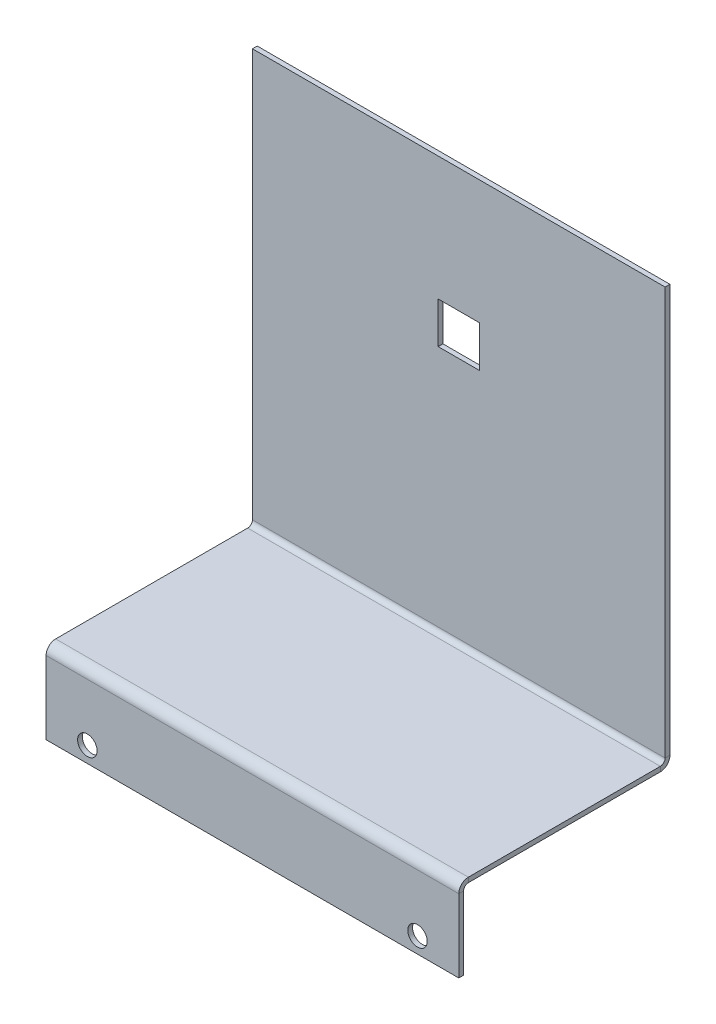
from build123d import *

# Parameters (mm, degrees)
BASE_FLANGE1_DEPTH = 63.5
HOLE1_START        = 28.172610526
HOLE1_OUTLINE_R    = 1.5
HOLE1_DEPTH        = 0.7366
SKETCH8_W          = 6.35
SKETCH8_H          = 6.35
CUT_EXTRUDE1_DEPTH = 90.436486872


# Read off the part's stored shape, not the designer's step: Hole1
# Sheet-metal steps are written as plain solids
with BuildPart() as part:
    # Sketch2 → Base-Flange1 (new body)
    with BuildSketch(Plane(origin=(0, 0, 0), x_dir=(0, 0, -1), z_dir=(1, 0, 0))):
        with BuildLine():
            Line((-28.909210526, -21.807236842), (-28.909210526, -10.580436842))
            ThreePointArc((-28.909210526, -10.580436842), (-28.477720236, -9.538727132), (-27.436010526, -9.107236842))
            Line((-27.436010526, -9.107236842), (2.104189474, -9.107236842))
            ThreePointArc((2.104189474, -9.107236842), (2.625044329, -8.891491697), (2.840789474, -8.370636842))
            Line((2.840789474, -8.370636842), (2.840789474, 54.392763158))
            Line((2.840789474, 54.392763158), (3.577389474, 54.392763158))
            Line((3.577389474, 54.392763158), (3.577389474, -8.370636842))
            ThreePointArc((3.577389474, -8.370636842), (3.145899184, -9.412346552), (2.104189474, -9.843836842))
            Line((2.104189474, -9.843836842), (-27.436010526, -9.843836842))
            ThreePointArc((-27.436010526, -9.843836842), (-27.956865381, -10.059581987), (-28.172610526, -10.580436842))
            Line((-28.172610526, -10.580436842), (-28.172610526, -21.807236842))
            Line((-28.172610526, -21.807236842), (-28.909210526, -21.807236842))
        make_face()
    extrude(amount=BASE_FLANGE1_DEPTH)

    # Hole1 outline → Hole1 (cut)
    with BuildSketch(Plane.XY.offset(HOLE1_START)):
        with Locations((6.35, -19.368836842)):
            Circle(HOLE1_OUTLINE_R)
        with Locations((57.15, -19.368836842)):
            Circle(HOLE1_OUTLINE_R)
    extrude(amount=HOLE1_DEPTH, mode=Mode.SUBTRACT)

    # Sketch8 → Cut-Extrude1 (cut, through all)
    with BuildSketch(Plane.XY.offset(-2.840789474)):
        with Locations((31.75, 32.167763158)):
            Rectangle(SKETCH8_W, SKETCH8_H)
    extrude(amount=-CUT_EXTRUDE1_DEPTH, mode=Mode.SUBTRACT)


solid = part.part
